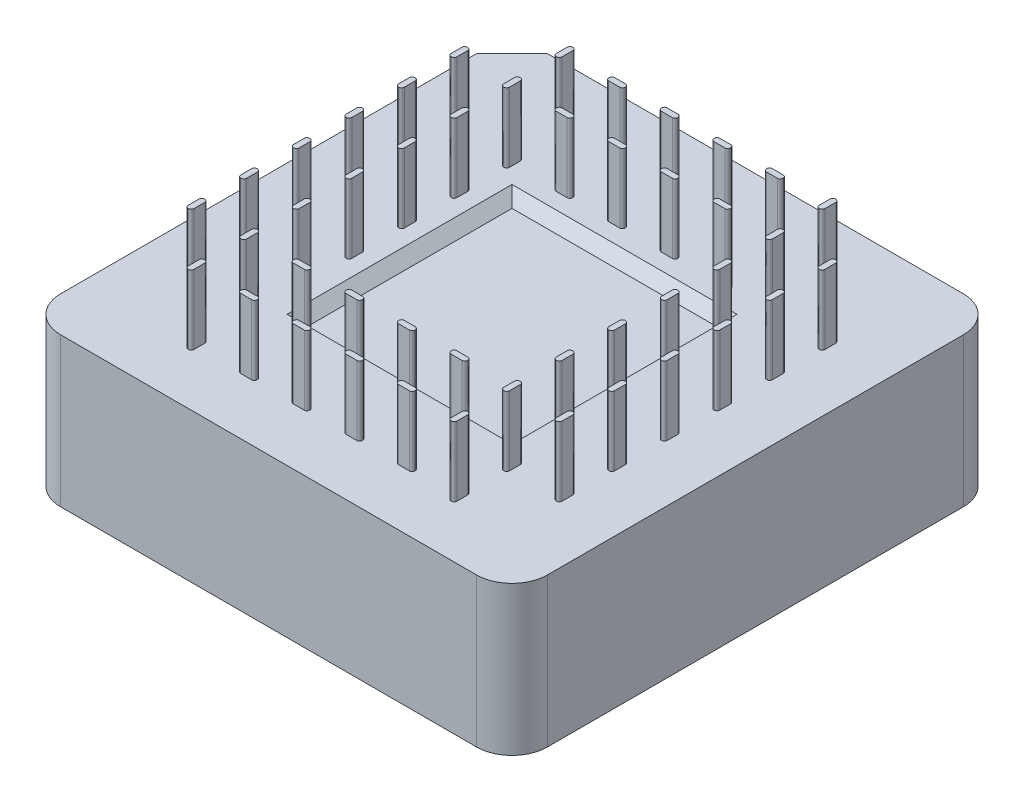
from build123d import *

# Parameters (mm, degrees)
SALIENTE_EXTRUIR1_DEPTH    = 3.3528
SALIENTE_EXTRUIR1_2_DEPTH  = 3.3528
SALIENTE_EXTRUIR1_3_DEPTH  = 3.3528
SALIENTE_EXTRUIR1_4_DEPTH  = 3.3528
SALIENTE_EXTRUIR1_5_DEPTH  = 3.3528
SALIENTE_EXTRUIR1_6_DEPTH  = 3.3528
SALIENTE_EXTRUIR1_7_DEPTH  = 3.3528
SALIENTE_EXTRUIR1_8_DEPTH  = 3.3528
SALIENTE_EXTRUIR1_9_DEPTH  = 3.3528
SALIENTE_EXTRUIR1_10_DEPTH = 3.3528
SALIENTE_EXTRUIR1_11_DEPTH = 3.3528
SALIENTE_EXTRUIR1_12_DEPTH = 3.3528
SALIENTE_EXTRUIR1_13_DEPTH = 3.3528
SALIENTE_EXTRUIR1_14_DEPTH = 3.3528
SALIENTE_EXTRUIR1_15_DEPTH = 3.3528
SALIENTE_EXTRUIR1_16_DEPTH = 3.3528
SALIENTE_EXTRUIR1_17_DEPTH = 3.3528
SALIENTE_EXTRUIR1_18_DEPTH = 3.3528
SALIENTE_EXTRUIR1_19_DEPTH = 3.3528
SALIENTE_EXTRUIR1_20_DEPTH = 3.3528
SALIENTE_EXTRUIR1_21_DEPTH = 3.3528
SALIENTE_EXTRUIR1_22_DEPTH = 3.3528
SALIENTE_EXTRUIR1_23_DEPTH = 3.3528
SALIENTE_EXTRUIR1_24_DEPTH = 3.3528
SALIENTE_EXTRUIR1_25_DEPTH = 3.3528
SALIENTE_EXTRUIR1_26_DEPTH = 3.3528
SALIENTE_EXTRUIR1_27_DEPTH = 3.3528
SALIENTE_EXTRUIR1_28_DEPTH = 3.3528
SALIENTE_EXTRUIR1_29_DEPTH = 3.3528
SALIENTE_EXTRUIR1_30_DEPTH = 3.3528
SALIENTE_EXTRUIR1_31_DEPTH = 3.3528
SALIENTE_EXTRUIR1_32_DEPTH = 3.3528
SALIENTE_EXTRUIR1_33_DEPTH = 3.3528
SALIENTE_EXTRUIR1_34_DEPTH = 3.3528
SALIENTE_EXTRUIR1_35_DEPTH = 3.3528
SALIENTE_EXTRUIR1_36_DEPTH = 3.3528
SALIENTE_EXTRUIR1_37_DEPTH = 3.3528
SALIENTE_EXTRUIR1_38_DEPTH = 3.3528
SALIENTE_EXTRUIR1_39_DEPTH = 3.3528
SALIENTE_EXTRUIR1_40_DEPTH = 3.3528
SALIENTE_EXTRUIR1_41_DEPTH = 3.3528
SALIENTE_EXTRUIR1_42_DEPTH = 3.3528
SALIENTE_EXTRUIR1_43_DEPTH = 3.3528
SALIENTE_EXTRUIR1_44_DEPTH = 3.3528
SALIENTE_EXTRUIR2_DEPTH    = 7.2
CROQUIS3_W                 = 11
CROQUIS3_H                 = 11
CORTAR_EXTRUIR1_DEPTH      = 0.5
CHAFL_N1_SIZE              = 0.569214
CORTAR_EXTRUIR2_DEPTH      = 5


with BuildPart() as part:
    # Croquis1 → Saliente-Extruir1 (new body)
    with BuildSketch(Plane(origin=(0, 0, 0), x_dir=(1, 0, 0), z_dir=(0, 1, 0))):
        with BuildLine():
            Line((-6.343218917, -8.4963), (-6.356781083, -8.4963))
            ThreePointArc((-6.356781083, -8.4963), (-6.450768951, -8.535231049), (-6.4897, -8.629218917))
            Line((-6.4897, -8.629218917), (-6.4897, -9.150781083))
            ThreePointArc((-6.4897, -9.150781083), (-6.450768951, -9.244768951), (-6.356781083, -9.2837))
            Line((-6.356781083, -9.2837), (-6.343218917, -9.2837))
            ThreePointArc((-6.343218917, -9.2837), (-6.249231049, -9.244768951), (-6.2103, -9.150781083))
            Line((-6.2103, -9.150781083), (-6.2103, -8.629218917))
            ThreePointArc((-6.2103, -8.629218917), (-6.249231049, -8.535231049), (-6.343218917, -8.4963))
        make_face()
    extrude(amount=SALIENTE_EXTRUIR1_DEPTH)



with BuildPart() as body_2:
    # Croquis1 → Saliente-Extruir1 2 (new body)
    with BuildSketch(Plane(origin=(0, 0, 0), x_dir=(1, 0, 0), z_dir=(0, 1, 0))):
        with BuildLine():
            Line((-8.896781083, -1.6637), (-8.883218917, -1.6637))
            ThreePointArc((-8.883218917, -1.6637), (-8.789231049, -1.624768951), (-8.7503, -1.530781083))
            Line((-8.7503, -1.530781083), (-8.7503, -1.009218917))
            ThreePointArc((-8.7503, -1.009218917), (-8.789231049, -0.915231049), (-8.883218917, -0.8763))
            Line((-8.883218917, -0.8763), (-8.896781083, -0.8763))
            ThreePointArc((-8.896781083, -0.8763), (-8.990768951, -0.915231049), (-9.0297, -1.009218917))
            Line((-9.0297, -1.009218917), (-9.0297, -1.530781083))
            ThreePointArc((-9.0297, -1.530781083), (-8.990768951, -1.624768951), (-8.896781083, -1.6637))
        make_face()
    extrude(amount=SALIENTE_EXTRUIR1_2_DEPTH)


with BuildPart() as body_3:
    # Croquis1 → Saliente-Extruir1 3 (new body)
    with BuildSketch(Plane(origin=(0, 0, 0), x_dir=(1, 0, 0), z_dir=(0, 1, 0))):
        with BuildLine():
            Line((-6.4897, -1.530781083), (-6.4897, -1.009218917))
            ThreePointArc((-6.4897, -1.009218917), (-6.450768951, -0.915231049), (-6.356781083, -0.8763))
            Line((-6.356781083, -0.8763), (-6.343218917, -0.8763))
            ThreePointArc((-6.343218917, -0.8763), (-6.249231049, -0.915231049), (-6.2103, -1.009218917))
            Line((-6.2103, -1.009218917), (-6.2103, -1.530781083))
            ThreePointArc((-6.2103, -1.530781083), (-6.249231049, -1.624768951), (-6.343218917, -1.6637))
            Line((-6.343218917, -1.6637), (-6.356781083, -1.6637))
            ThreePointArc((-6.356781083, -1.6637), (-6.450768951, -1.624768951), (-6.4897, -1.530781083))
        make_face()
    extrude(amount=SALIENTE_EXTRUIR1_3_DEPTH)


with BuildPart() as body_4:
    # Croquis1 → Saliente-Extruir1 4 (new body)
    with BuildSketch(Plane(origin=(0, 0, 0), x_dir=(1, 0, 0), z_dir=(0, 1, 0))):
        with BuildLine():
            Line((-6.343218917, -3.4163), (-6.356781083, -3.4163))
            ThreePointArc((-6.356781083, -3.4163), (-6.450768951, -3.455231049), (-6.4897, -3.549218917))
            Line((-6.4897, -3.549218917), (-6.4897, -4.070781083))
            ThreePointArc((-6.4897, -4.070781083), (-6.450768951, -4.164768951), (-6.356781083, -4.2037))
            Line((-6.356781083, -4.2037), (-6.343218917, -4.2037))
            ThreePointArc((-6.343218917, -4.2037), (-6.249231049, -4.164768951), (-6.2103, -4.070781083))
            Line((-6.2103, -4.070781083), (-6.2103, -3.549218917))
            ThreePointArc((-6.2103, -3.549218917), (-6.249231049, -3.455231049), (-6.343218917, -3.4163))
        make_face()
    extrude(amount=SALIENTE_EXTRUIR1_4_DEPTH)


with BuildPart() as body_5:
    # Croquis1 → Saliente-Extruir1 5 (new body)
    with BuildSketch(Plane(origin=(0, 0, 0), x_dir=(1, 0, 0), z_dir=(0, 1, 0))):
        with BuildLine():
            Line((-8.7503, -3.549218917), (-8.7503, -4.070781083))
            ThreePointArc((-8.7503, -4.070781083), (-8.789231049, -4.164768951), (-8.883218917, -4.2037))
            Line((-8.883218917, -4.2037), (-8.896781083, -4.2037))
            ThreePointArc((-8.896781083, -4.2037), (-8.990768951, -4.164768951), (-9.0297, -4.070781083))
            Line((-9.0297, -4.070781083), (-9.0297, -3.549218917))
            ThreePointArc((-9.0297, -3.549218917), (-8.990768951, -3.455231049), (-8.896781083, -3.4163))
            Line((-8.896781083, -3.4163), (-8.883218917, -3.4163))
            ThreePointArc((-8.883218917, -3.4163), (-8.789231049, -3.455231049), (-8.7503, -3.549218917))
        make_face()
    extrude(amount=SALIENTE_EXTRUIR1_5_DEPTH)


with BuildPart() as body_6:
    # Croquis1 → Saliente-Extruir1 6 (new body)
    with BuildSketch(Plane(origin=(0, 0, 0), x_dir=(1, 0, 0), z_dir=(0, 1, 0))):
        with BuildLine():
            Line((-8.896781083, -6.7437), (-8.883218917, -6.7437))
            ThreePointArc((-8.883218917, -6.7437), (-8.789231049, -6.704768951), (-8.7503, -6.610781083))
            Line((-8.7503, -6.610781083), (-8.7503, -6.089218917))
            ThreePointArc((-8.7503, -6.089218917), (-8.789231049, -5.995231049), (-8.883218917, -5.9563))
            Line((-8.883218917, -5.9563), (-8.896781083, -5.9563))
            ThreePointArc((-8.896781083, -5.9563), (-8.990768951, -5.995231049), (-9.0297, -6.089218917))
            Line((-9.0297, -6.089218917), (-9.0297, -6.610781083))
            ThreePointArc((-9.0297, -6.610781083), (-8.990768951, -6.704768951), (-8.896781083, -6.7437))
        make_face()
    extrude(amount=SALIENTE_EXTRUIR1_6_DEPTH)


with BuildPart() as body_7:
    # Croquis1 → Saliente-Extruir1 7 (new body)
    with BuildSketch(Plane(origin=(0, 0, 0), x_dir=(1, 0, 0), z_dir=(0, 1, 0))):
        with BuildLine():
            Line((-6.4897, -6.610781083), (-6.4897, -6.089218917))
            ThreePointArc((-6.4897, -6.089218917), (-6.450768951, -5.995231049), (-6.356781083, -5.9563))
            Line((-6.356781083, -5.9563), (-6.343218917, -5.9563))
            ThreePointArc((-6.343218917, -5.9563), (-6.249231049, -5.995231049), (-6.2103, -6.089218917))
            Line((-6.2103, -6.089218917), (-6.2103, -6.610781083))
            ThreePointArc((-6.2103, -6.610781083), (-6.249231049, -6.704768951), (-6.343218917, -6.7437))
            Line((-6.343218917, -6.7437), (-6.356781083, -6.7437))
            ThreePointArc((-6.356781083, -6.7437), (-6.450768951, -6.704768951), (-6.4897, -6.610781083))
        make_face()
    extrude(amount=SALIENTE_EXTRUIR1_7_DEPTH)


with BuildPart() as body_8:
    # Croquis1 → Saliente-Extruir1 8 (new body)
    with BuildSketch(Plane(origin=(0, 0, 0), x_dir=(1, 0, 0), z_dir=(0, 1, 0))):
        with BuildLine():
            Line((-6.343218917, 6.7437), (-6.356781083, 6.7437))
            ThreePointArc((-6.356781083, 6.7437), (-6.450768951, 6.704768951), (-6.4897, 6.610781083))
            Line((-6.4897, 6.610781083), (-6.4897, 6.089218917))
            ThreePointArc((-6.4897, 6.089218917), (-6.450768951, 5.995231049), (-6.356781083, 5.9563))
            Line((-6.356781083, 5.9563), (-6.343218917, 5.9563))
            ThreePointArc((-6.343218917, 5.9563), (-6.249231049, 5.995231049), (-6.2103, 6.089218917))
            Line((-6.2103, 6.089218917), (-6.2103, 6.610781083))
            ThreePointArc((-6.2103, 6.610781083), (-6.249231049, 6.704768951), (-6.343218917, 6.7437))
        make_face()
    extrude(amount=SALIENTE_EXTRUIR1_8_DEPTH)


with BuildPart() as body_9:
    # Croquis1 → Saliente-Extruir1 9 (new body)
    with BuildSketch(Plane(origin=(0, 0, 0), x_dir=(1, 0, 0), z_dir=(0, 1, 0))):
        with BuildLine():
            Line((-8.7503, 6.610781083), (-8.7503, 6.089218917))
            ThreePointArc((-8.7503, 6.089218917), (-8.789231049, 5.995231049), (-8.883218917, 5.9563))
            Line((-8.883218917, 5.9563), (-8.896781083, 5.9563))
            ThreePointArc((-8.896781083, 5.9563), (-8.990768951, 5.995231049), (-9.0297, 6.089218917))
            Line((-9.0297, 6.089218917), (-9.0297, 6.610781083))
            ThreePointArc((-9.0297, 6.610781083), (-8.990768951, 6.704768951), (-8.896781083, 6.7437))
            Line((-8.896781083, 6.7437), (-8.883218917, 6.7437))
            ThreePointArc((-8.883218917, 6.7437), (-8.789231049, 6.704768951), (-8.7503, 6.610781083))
        make_face()
    extrude(amount=SALIENTE_EXTRUIR1_9_DEPTH)


with BuildPart() as body_10:
    # Croquis1 → Saliente-Extruir1 10 (new body)
    with BuildSketch(Plane(origin=(0, 0, 0), x_dir=(1, 0, 0), z_dir=(0, 1, 0))):
        with BuildLine():
            Line((-8.896781083, 3.4163), (-8.883218917, 3.4163))
            ThreePointArc((-8.883218917, 3.4163), (-8.789231049, 3.455231049), (-8.7503, 3.549218917))
            Line((-8.7503, 3.549218917), (-8.7503, 4.070781083))
            ThreePointArc((-8.7503, 4.070781083), (-8.789231049, 4.164768951), (-8.883218917, 4.2037))
            Line((-8.883218917, 4.2037), (-8.896781083, 4.2037))
            ThreePointArc((-8.896781083, 4.2037), (-8.990768951, 4.164768951), (-9.0297, 4.070781083))
            Line((-9.0297, 4.070781083), (-9.0297, 3.549218917))
            ThreePointArc((-9.0297, 3.549218917), (-8.990768951, 3.455231049), (-8.896781083, 3.4163))
        make_face()
    extrude(amount=SALIENTE_EXTRUIR1_10_DEPTH)


with BuildPart() as body_11:
    # Croquis1 → Saliente-Extruir1 11 (new body)
    with BuildSketch(Plane(origin=(0, 0, 0), x_dir=(1, 0, 0), z_dir=(0, 1, 0))):
        with BuildLine():
            Line((-6.4897, 3.549218917), (-6.4897, 4.070781083))
            ThreePointArc((-6.4897, 4.070781083), (-6.450768951, 4.164768951), (-6.356781083, 4.2037))
            Line((-6.356781083, 4.2037), (-6.343218917, 4.2037))
            ThreePointArc((-6.343218917, 4.2037), (-6.249231049, 4.164768951), (-6.2103, 4.070781083))
            Line((-6.2103, 4.070781083), (-6.2103, 3.549218917))
            ThreePointArc((-6.2103, 3.549218917), (-6.249231049, 3.455231049), (-6.343218917, 3.4163))
            Line((-6.343218917, 3.4163), (-6.356781083, 3.4163))
            ThreePointArc((-6.356781083, 3.4163), (-6.450768951, 3.455231049), (-6.4897, 3.549218917))
        make_face()
    extrude(amount=SALIENTE_EXTRUIR1_11_DEPTH)


with BuildPart() as body_12:
    # Croquis1 → Saliente-Extruir1 12 (new body)
    with BuildSketch(Plane(origin=(0, 0, 0), x_dir=(1, 0, 0), z_dir=(0, 1, 0))):
        with BuildLine():
            Line((-6.343218917, 1.6637), (-6.356781083, 1.6637))
            ThreePointArc((-6.356781083, 1.6637), (-6.450768951, 1.624768951), (-6.4897, 1.530781083))
            Line((-6.4897, 1.530781083), (-6.4897, 1.009218917))
            ThreePointArc((-6.4897, 1.009218917), (-6.450768951, 0.915231049), (-6.356781083, 0.8763))
            Line((-6.356781083, 0.8763), (-6.343218917, 0.8763))
            ThreePointArc((-6.343218917, 0.8763), (-6.249231049, 0.915231049), (-6.2103, 1.009218917))
            Line((-6.2103, 1.009218917), (-6.2103, 1.530781083))
            ThreePointArc((-6.2103, 1.530781083), (-6.249231049, 1.624768951), (-6.343218917, 1.6637))
        make_face()
    extrude(amount=SALIENTE_EXTRUIR1_12_DEPTH)


with BuildPart() as body_13:
    # Croquis1 → Saliente-Extruir1 13 (new body)
    with BuildSketch(Plane(origin=(0, 0, 0), x_dir=(1, 0, 0), z_dir=(0, 1, 0))):
        with BuildLine():
            Line((-8.7503, 1.530781083), (-8.7503, 1.009218917))
            ThreePointArc((-8.7503, 1.009218917), (-8.789231049, 0.915231049), (-8.883218917, 0.8763))
            Line((-8.883218917, 0.8763), (-8.896781083, 0.8763))
            ThreePointArc((-8.896781083, 0.8763), (-8.990768951, 0.915231049), (-9.0297, 1.009218917))
            Line((-9.0297, 1.009218917), (-9.0297, 1.530781083))
            ThreePointArc((-9.0297, 1.530781083), (-8.990768951, 1.624768951), (-8.896781083, 1.6637))
            Line((-8.896781083, 1.6637), (-8.883218917, 1.6637))
            ThreePointArc((-8.883218917, 1.6637), (-8.789231049, 1.624768951), (-8.7503, 1.530781083))
        make_face()
    extrude(amount=SALIENTE_EXTRUIR1_13_DEPTH)


with BuildPart() as body_14:
    # Croquis1 → Saliente-Extruir1 14 (new body)
    with BuildSketch(Plane(origin=(0, 0, 0), x_dir=(1, 0, 0), z_dir=(0, 1, 0))):
        with BuildLine():
            Line((-6.4897, 8.629218917), (-6.4897, 9.150781083))
            ThreePointArc((-6.4897, 9.150781083), (-6.450768951, 9.244768951), (-6.356781083, 9.2837))
            Line((-6.356781083, 9.2837), (-6.343218917, 9.2837))
            ThreePointArc((-6.343218917, 9.2837), (-6.249231049, 9.244768951), (-6.2103, 9.150781083))
            Line((-6.2103, 9.150781083), (-6.2103, 8.629218917))
            ThreePointArc((-6.2103, 8.629218917), (-6.249231049, 8.535231049), (-6.343218917, 8.4963))
            Line((-6.343218917, 8.4963), (-6.356781083, 8.4963))
            ThreePointArc((-6.356781083, 8.4963), (-6.450768951, 8.535231049), (-6.4897, 8.629218917))
        make_face()
    extrude(amount=SALIENTE_EXTRUIR1_14_DEPTH)


with BuildPart() as body_15:
    # Croquis1 → Saliente-Extruir1 15 (new body)
    with BuildSketch(Plane(origin=(0, 0, 0), x_dir=(1, 0, 0), z_dir=(0, 1, 0))):
        with BuildLine():
            Line((6.343218917, 8.4963), (6.356781083, 8.4963))
            ThreePointArc((6.356781083, 8.4963), (6.450768951, 8.535231049), (6.4897, 8.629218917))
            Line((6.4897, 8.629218917), (6.4897, 9.150781083))
            ThreePointArc((6.4897, 9.150781083), (6.450768951, 9.244768951), (6.356781083, 9.2837))
            Line((6.356781083, 9.2837), (6.343218917, 9.2837))
            ThreePointArc((6.343218917, 9.2837), (6.249231049, 9.244768951), (6.2103, 9.150781083))
            Line((6.2103, 9.150781083), (6.2103, 8.629218917))
            ThreePointArc((6.2103, 8.629218917), (6.249231049, 8.535231049), (6.343218917, 8.4963))
        make_face()
    extrude(amount=SALIENTE_EXTRUIR1_15_DEPTH)


with BuildPart() as body_16:
    # Croquis1 → Saliente-Extruir1 16 (new body)
    with BuildSketch(Plane(origin=(0, 0, 0), x_dir=(1, 0, 0), z_dir=(0, 1, 0))):
        with BuildLine():
            Line((8.896781083, 1.6637), (8.883218917, 1.6637))
            ThreePointArc((8.883218917, 1.6637), (8.789231049, 1.624768951), (8.7503, 1.530781083))
            Line((8.7503, 1.530781083), (8.7503, 1.009218917))
            ThreePointArc((8.7503, 1.009218917), (8.789231049, 0.915231049), (8.883218917, 0.8763))
            Line((8.883218917, 0.8763), (8.896781083, 0.8763))
            ThreePointArc((8.896781083, 0.8763), (8.990768951, 0.915231049), (9.0297, 1.009218917))
            Line((9.0297, 1.009218917), (9.0297, 1.530781083))
            ThreePointArc((9.0297, 1.530781083), (8.990768951, 1.624768951), (8.896781083, 1.6637))
        make_face()
    extrude(amount=SALIENTE_EXTRUIR1_16_DEPTH)


with BuildPart() as body_17:
    # Croquis1 → Saliente-Extruir1 17 (new body)
    with BuildSketch(Plane(origin=(0, 0, 0), x_dir=(1, 0, 0), z_dir=(0, 1, 0))):
        with BuildLine():
            Line((6.4897, 1.530781083), (6.4897, 1.009218917))
            ThreePointArc((6.4897, 1.009218917), (6.450768951, 0.915231049), (6.356781083, 0.8763))
            Line((6.356781083, 0.8763), (6.343218917, 0.8763))
            ThreePointArc((6.343218917, 0.8763), (6.249231049, 0.915231049), (6.2103, 1.009218917))
            Line((6.2103, 1.009218917), (6.2103, 1.530781083))
            ThreePointArc((6.2103, 1.530781083), (6.249231049, 1.624768951), (6.343218917, 1.6637))
            Line((6.343218917, 1.6637), (6.356781083, 1.6637))
            ThreePointArc((6.356781083, 1.6637), (6.450768951, 1.624768951), (6.4897, 1.530781083))
        make_face()
    extrude(amount=SALIENTE_EXTRUIR1_17_DEPTH)


with BuildPart() as body_18:
    # Croquis1 → Saliente-Extruir1 18 (new body)
    with BuildSketch(Plane(origin=(0, 0, 0), x_dir=(1, 0, 0), z_dir=(0, 1, 0))):
        with BuildLine():
            Line((6.343218917, 3.4163), (6.356781083, 3.4163))
            ThreePointArc((6.356781083, 3.4163), (6.450768951, 3.455231049), (6.4897, 3.549218917))
            Line((6.4897, 3.549218917), (6.4897, 4.070781083))
            ThreePointArc((6.4897, 4.070781083), (6.450768951, 4.164768951), (6.356781083, 4.2037))
            Line((6.356781083, 4.2037), (6.343218917, 4.2037))
            ThreePointArc((6.343218917, 4.2037), (6.249231049, 4.164768951), (6.2103, 4.070781083))
            Line((6.2103, 4.070781083), (6.2103, 3.549218917))
            ThreePointArc((6.2103, 3.549218917), (6.249231049, 3.455231049), (6.343218917, 3.4163))
        make_face()
    extrude(amount=SALIENTE_EXTRUIR1_18_DEPTH)


with BuildPart() as body_19:
    # Croquis1 → Saliente-Extruir1 19 (new body)
    with BuildSketch(Plane(origin=(0, 0, 0), x_dir=(1, 0, 0), z_dir=(0, 1, 0))):
        with BuildLine():
            Line((8.7503, 3.549218917), (8.7503, 4.070781083))
            ThreePointArc((8.7503, 4.070781083), (8.789231049, 4.164768951), (8.883218917, 4.2037))
            Line((8.883218917, 4.2037), (8.896781083, 4.2037))
            ThreePointArc((8.896781083, 4.2037), (8.990768951, 4.164768951), (9.0297, 4.070781083))
            Line((9.0297, 4.070781083), (9.0297, 3.549218917))
            ThreePointArc((9.0297, 3.549218917), (8.990768951, 3.455231049), (8.896781083, 3.4163))
            Line((8.896781083, 3.4163), (8.883218917, 3.4163))
            ThreePointArc((8.883218917, 3.4163), (8.789231049, 3.455231049), (8.7503, 3.549218917))
        make_face()
    extrude(amount=SALIENTE_EXTRUIR1_19_DEPTH)


with BuildPart() as body_20:
    # Croquis1 → Saliente-Extruir1 20 (new body)
    with BuildSketch(Plane(origin=(0, 0, 0), x_dir=(1, 0, 0), z_dir=(0, 1, 0))):
        with BuildLine():
            Line((8.896781083, 6.7437), (8.883218917, 6.7437))
            ThreePointArc((8.883218917, 6.7437), (8.789231049, 6.704768951), (8.7503, 6.610781083))
            Line((8.7503, 6.610781083), (8.7503, 6.089218917))
            ThreePointArc((8.7503, 6.089218917), (8.789231049, 5.995231049), (8.883218917, 5.9563))
            Line((8.883218917, 5.9563), (8.896781083, 5.9563))
            ThreePointArc((8.896781083, 5.9563), (8.990768951, 5.995231049), (9.0297, 6.089218917))
            Line((9.0297, 6.089218917), (9.0297, 6.610781083))
            ThreePointArc((9.0297, 6.610781083), (8.990768951, 6.704768951), (8.896781083, 6.7437))
        make_face()
    extrude(amount=SALIENTE_EXTRUIR1_20_DEPTH)


with BuildPart() as body_21:
    # Croquis1 → Saliente-Extruir1 21 (new body)
    with BuildSketch(Plane(origin=(0, 0, 0), x_dir=(1, 0, 0), z_dir=(0, 1, 0))):
        with BuildLine():
            Line((6.4897, 6.610781083), (6.4897, 6.089218917))
            ThreePointArc((6.4897, 6.089218917), (6.450768951, 5.995231049), (6.356781083, 5.9563))
            Line((6.356781083, 5.9563), (6.343218917, 5.9563))
            ThreePointArc((6.343218917, 5.9563), (6.249231049, 5.995231049), (6.2103, 6.089218917))
            Line((6.2103, 6.089218917), (6.2103, 6.610781083))
            ThreePointArc((6.2103, 6.610781083), (6.249231049, 6.704768951), (6.343218917, 6.7437))
            Line((6.343218917, 6.7437), (6.356781083, 6.7437))
            ThreePointArc((6.356781083, 6.7437), (6.450768951, 6.704768951), (6.4897, 6.610781083))
        make_face()
    extrude(amount=SALIENTE_EXTRUIR1_21_DEPTH)


with BuildPart() as body_22:
    # Croquis1 → Saliente-Extruir1 22 (new body)
    with BuildSketch(Plane(origin=(0, 0, 0), x_dir=(1, 0, 0), z_dir=(0, 1, 0))):
        with BuildLine():
            Line((6.343218917, -6.7437), (6.356781083, -6.7437))
            ThreePointArc((6.356781083, -6.7437), (6.450768951, -6.704768951), (6.4897, -6.610781083))
            Line((6.4897, -6.610781083), (6.4897, -6.089218917))
            ThreePointArc((6.4897, -6.089218917), (6.450768951, -5.995231049), (6.356781083, -5.9563))
            Line((6.356781083, -5.9563), (6.343218917, -5.9563))
            ThreePointArc((6.343218917, -5.9563), (6.249231049, -5.995231049), (6.2103, -6.089218917))
            Line((6.2103, -6.089218917), (6.2103, -6.610781083))
            ThreePointArc((6.2103, -6.610781083), (6.249231049, -6.704768951), (6.343218917, -6.7437))
        make_face()
    extrude(amount=SALIENTE_EXTRUIR1_22_DEPTH)


with BuildPart() as body_23:
    # Croquis1 → Saliente-Extruir1 23 (new body)
    with BuildSketch(Plane(origin=(0, 0, 0), x_dir=(1, 0, 0), z_dir=(0, 1, 0))):
        with BuildLine():
            Line((8.7503, -6.610781083), (8.7503, -6.089218917))
            ThreePointArc((8.7503, -6.089218917), (8.789231049, -5.995231049), (8.883218917, -5.9563))
            Line((8.883218917, -5.9563), (8.896781083, -5.9563))
            ThreePointArc((8.896781083, -5.9563), (8.990768951, -5.995231049), (9.0297, -6.089218917))
            Line((9.0297, -6.089218917), (9.0297, -6.610781083))
            ThreePointArc((9.0297, -6.610781083), (8.990768951, -6.704768951), (8.896781083, -6.7437))
            Line((8.896781083, -6.7437), (8.883218917, -6.7437))
            ThreePointArc((8.883218917, -6.7437), (8.789231049, -6.704768951), (8.7503, -6.610781083))
        make_face()
    extrude(amount=SALIENTE_EXTRUIR1_23_DEPTH)


with BuildPart() as body_24:
    # Croquis1 → Saliente-Extruir1 24 (new body)
    with BuildSketch(Plane(origin=(0, 0, 0), x_dir=(1, 0, 0), z_dir=(0, 1, 0))):
        with BuildLine():
            Line((8.896781083, -3.4163), (8.883218917, -3.4163))
            ThreePointArc((8.883218917, -3.4163), (8.789231049, -3.455231049), (8.7503, -3.549218917))
            Line((8.7503, -3.549218917), (8.7503, -4.070781083))
            ThreePointArc((8.7503, -4.070781083), (8.789231049, -4.164768951), (8.883218917, -4.2037))
            Line((8.883218917, -4.2037), (8.896781083, -4.2037))
            ThreePointArc((8.896781083, -4.2037), (8.990768951, -4.164768951), (9.0297, -4.070781083))
            Line((9.0297, -4.070781083), (9.0297, -3.549218917))
            ThreePointArc((9.0297, -3.549218917), (8.990768951, -3.455231049), (8.896781083, -3.4163))
        make_face()
    extrude(amount=SALIENTE_EXTRUIR1_24_DEPTH)


with BuildPart() as body_25:
    # Croquis1 → Saliente-Extruir1 25 (new body)
    with BuildSketch(Plane(origin=(0, 0, 0), x_dir=(1, 0, 0), z_dir=(0, 1, 0))):
        with BuildLine():
            Line((6.4897, -3.549218917), (6.4897, -4.070781083))
            ThreePointArc((6.4897, -4.070781083), (6.450768951, -4.164768951), (6.356781083, -4.2037))
            Line((6.356781083, -4.2037), (6.343218917, -4.2037))
            ThreePointArc((6.343218917, -4.2037), (6.249231049, -4.164768951), (6.2103, -4.070781083))
            Line((6.2103, -4.070781083), (6.2103, -3.549218917))
            ThreePointArc((6.2103, -3.549218917), (6.249231049, -3.455231049), (6.343218917, -3.4163))
            Line((6.343218917, -3.4163), (6.356781083, -3.4163))
            ThreePointArc((6.356781083, -3.4163), (6.450768951, -3.455231049), (6.4897, -3.549218917))
        make_face()
    extrude(amount=SALIENTE_EXTRUIR1_25_DEPTH)


with BuildPart() as body_26:
    # Croquis1 → Saliente-Extruir1 26 (new body)
    with BuildSketch(Plane(origin=(0, 0, 0), x_dir=(1, 0, 0), z_dir=(0, 1, 0))):
        with BuildLine():
            Line((6.343218917, -1.6637), (6.356781083, -1.6637))
            ThreePointArc((6.356781083, -1.6637), (6.450768951, -1.624768951), (6.4897, -1.530781083))
            Line((6.4897, -1.530781083), (6.4897, -1.009218917))
            ThreePointArc((6.4897, -1.009218917), (6.450768951, -0.915231049), (6.356781083, -0.8763))
            Line((6.356781083, -0.8763), (6.343218917, -0.8763))
            ThreePointArc((6.343218917, -0.8763), (6.249231049, -0.915231049), (6.2103, -1.009218917))
            Line((6.2103, -1.009218917), (6.2103, -1.530781083))
            ThreePointArc((6.2103, -1.530781083), (6.249231049, -1.624768951), (6.343218917, -1.6637))
        make_face()
    extrude(amount=SALIENTE_EXTRUIR1_26_DEPTH)


with BuildPart() as body_27:
    # Croquis1 → Saliente-Extruir1 27 (new body)
    with BuildSketch(Plane(origin=(0, 0, 0), x_dir=(1, 0, 0), z_dir=(0, 1, 0))):
        with BuildLine():
            Line((8.7503, -1.530781083), (8.7503, -1.009218917))
            ThreePointArc((8.7503, -1.009218917), (8.789231049, -0.915231049), (8.883218917, -0.8763))
            Line((8.883218917, -0.8763), (8.896781083, -0.8763))
            ThreePointArc((8.896781083, -0.8763), (8.990768951, -0.915231049), (9.0297, -1.009218917))
            Line((9.0297, -1.009218917), (9.0297, -1.530781083))
            ThreePointArc((9.0297, -1.530781083), (8.990768951, -1.624768951), (8.896781083, -1.6637))
            Line((8.896781083, -1.6637), (8.883218917, -1.6637))
            ThreePointArc((8.883218917, -1.6637), (8.789231049, -1.624768951), (8.7503, -1.530781083))
        make_face()
    extrude(amount=SALIENTE_EXTRUIR1_27_DEPTH)


with BuildPart() as body_28:
    # Croquis1 → Saliente-Extruir1 28 (new body)
    with BuildSketch(Plane(origin=(0, 0, 0), x_dir=(1, 0, 0), z_dir=(0, 1, 0))):
        with BuildLine():
            Line((6.4897, -8.629218917), (6.4897, -9.150781083))
            ThreePointArc((6.4897, -9.150781083), (6.450768951, -9.244768951), (6.356781083, -9.2837))
            Line((6.356781083, -9.2837), (6.343218917, -9.2837))
            ThreePointArc((6.343218917, -9.2837), (6.249231049, -9.244768951), (6.2103, -9.150781083))
            Line((6.2103, -9.150781083), (6.2103, -8.629218917))
            ThreePointArc((6.2103, -8.629218917), (6.249231049, -8.535231049), (6.343218917, -8.4963))
            Line((6.343218917, -8.4963), (6.356781083, -8.4963))
            ThreePointArc((6.356781083, -8.4963), (6.450768951, -8.535231049), (6.4897, -8.629218917))
        make_face()
    extrude(amount=SALIENTE_EXTRUIR1_28_DEPTH)


with BuildPart() as body_29:
    # Croquis1 → Saliente-Extruir1 29 (new body)
    with BuildSketch(Plane(origin=(0, 0, 0), x_dir=(1, 0, 0), z_dir=(0, 1, 0))):
        with BuildLine():
            Line((-3.542618838, -6.2103), (-4.077381162, -6.2103))
            ThreePointArc((-4.077381162, -6.2103), (-4.166702069, -6.247297931), (-4.2037, -6.336618838))
            Line((-4.2037, -6.336618838), (-4.2037, -6.363381162))
            ThreePointArc((-4.2037, -6.363381162), (-4.166702069, -6.452702069), (-4.077381162, -6.4897))
            Line((-4.077381162, -6.4897), (-3.542618838, -6.4897))
            ThreePointArc((-3.542618838, -6.4897), (-3.453297931, -6.452702069), (-3.4163, -6.363381162))
            Line((-3.4163, -6.363381162), (-3.4163, -6.336618838))
            ThreePointArc((-3.4163, -6.336618838), (-3.453297931, -6.247297931), (-3.542618838, -6.2103))
        make_face()
    extrude(amount=SALIENTE_EXTRUIR1_29_DEPTH)


with BuildPart() as body_30:
    # Croquis1 → Saliente-Extruir1 30 (new body)
    with BuildSketch(Plane(origin=(0, 0, 0), x_dir=(1, 0, 0), z_dir=(0, 1, 0))):
        with BuildLine():
            Line((-0.8763, -6.336618838), (-0.8763, -6.363381162))
            ThreePointArc((-0.8763, -6.363381162), (-0.913297931, -6.452702069), (-1.002618838, -6.4897))
            Line((-1.002618838, -6.4897), (-1.537381162, -6.4897))
            ThreePointArc((-1.537381162, -6.4897), (-1.626702069, -6.452702069), (-1.6637, -6.363381162))
            Line((-1.6637, -6.363381162), (-1.6637, -6.336618838))
            ThreePointArc((-1.6637, -6.336618838), (-1.626702069, -6.247297931), (-1.537381162, -6.2103))
            Line((-1.537381162, -6.2103), (-1.002618838, -6.2103))
            ThreePointArc((-1.002618838, -6.2103), (-0.913297931, -6.247297931), (-0.8763, -6.336618838))
        make_face()
    extrude(amount=SALIENTE_EXTRUIR1_30_DEPTH)


with BuildPart() as body_31:
    # Croquis1 → Saliente-Extruir1 31 (new body)
    with BuildSketch(Plane(origin=(0, 0, 0), x_dir=(1, 0, 0), z_dir=(0, 1, 0))):
        with BuildLine():
            Line((1.537381162, -6.2103), (1.002618838, -6.2103))
            ThreePointArc((1.002618838, -6.2103), (0.913297931, -6.247297931), (0.8763, -6.336618838))
            Line((0.8763, -6.336618838), (0.8763, -6.363381162))
            ThreePointArc((0.8763, -6.363381162), (0.913297931, -6.452702069), (1.002618838, -6.4897))
            Line((1.002618838, -6.4897), (1.537381162, -6.4897))
            ThreePointArc((1.537381162, -6.4897), (1.626702069, -6.452702069), (1.6637, -6.363381162))
            Line((1.6637, -6.363381162), (1.6637, -6.336618838))
            ThreePointArc((1.6637, -6.336618838), (1.626702069, -6.247297931), (1.537381162, -6.2103))
        make_face()
    extrude(amount=SALIENTE_EXTRUIR1_31_DEPTH)


with BuildPart() as body_32:
    # Croquis1 → Saliente-Extruir1 32 (new body)
    with BuildSketch(Plane(origin=(0, 0, 0), x_dir=(1, 0, 0), z_dir=(0, 1, 0))):
        with BuildLine():
            Line((4.2037, -6.336618838), (4.2037, -6.363381162))
            ThreePointArc((4.2037, -6.363381162), (4.166702069, -6.452702069), (4.077381162, -6.4897))
            Line((4.077381162, -6.4897), (3.542618838, -6.4897))
            ThreePointArc((3.542618838, -6.4897), (3.453297931, -6.452702069), (3.4163, -6.363381162))
            Line((3.4163, -6.363381162), (3.4163, -6.336618838))
            ThreePointArc((3.4163, -6.336618838), (3.453297931, -6.247297931), (3.542618838, -6.2103))
            Line((3.542618838, -6.2103), (4.077381162, -6.2103))
            ThreePointArc((4.077381162, -6.2103), (4.166702069, -6.247297931), (4.2037, -6.336618838))
        make_face()
    extrude(amount=SALIENTE_EXTRUIR1_32_DEPTH)


with BuildPart() as body_33:
    # Croquis1 → Saliente-Extruir1 33 (new body)
    with BuildSketch(Plane(origin=(0, 0, 0), x_dir=(1, 0, 0), z_dir=(0, 1, 0))):
        with BuildLine():
            Line((3.542618838, -9.0297), (4.077381162, -9.0297))
            ThreePointArc((4.077381162, -9.0297), (4.166702069, -8.992702069), (4.2037, -8.903381162))
            Line((4.2037, -8.903381162), (4.2037, -8.876618838))
            ThreePointArc((4.2037, -8.876618838), (4.166702069, -8.787297931), (4.077381162, -8.7503))
            Line((4.077381162, -8.7503), (3.542618838, -8.7503))
            ThreePointArc((3.542618838, -8.7503), (3.453297931, -8.787297931), (3.4163, -8.876618838))
            Line((3.4163, -8.876618838), (3.4163, -8.903381162))
            ThreePointArc((3.4163, -8.903381162), (3.453297931, -8.992702069), (3.542618838, -9.0297))
        make_face()
    extrude(amount=SALIENTE_EXTRUIR1_33_DEPTH)


with BuildPart() as body_34:
    # Croquis1 → Saliente-Extruir1 34 (new body)
    with BuildSketch(Plane(origin=(0, 0, 0), x_dir=(1, 0, 0), z_dir=(0, 1, 0))):
        with BuildLine():
            Line((0.8763, -8.903381162), (0.8763, -8.876618838))
            ThreePointArc((0.8763, -8.876618838), (0.913297931, -8.787297931), (1.002618838, -8.7503))
            Line((1.002618838, -8.7503), (1.537381162, -8.7503))
            ThreePointArc((1.537381162, -8.7503), (1.626702069, -8.787297931), (1.6637, -8.876618838))
            Line((1.6637, -8.876618838), (1.6637, -8.903381162))
            ThreePointArc((1.6637, -8.903381162), (1.626702069, -8.992702069), (1.537381162, -9.0297))
            Line((1.537381162, -9.0297), (1.002618838, -9.0297))
            ThreePointArc((1.002618838, -9.0297), (0.913297931, -8.992702069), (0.8763, -8.903381162))
        make_face()
    extrude(amount=SALIENTE_EXTRUIR1_34_DEPTH)


with BuildPart() as body_35:
    # Croquis1 → Saliente-Extruir1 35 (new body)
    with BuildSketch(Plane(origin=(0, 0, 0), x_dir=(1, 0, 0), z_dir=(0, 1, 0))):
        with BuildLine():
            Line((-1.537381162, -9.0297), (-1.002618838, -9.0297))
            ThreePointArc((-1.002618838, -9.0297), (-0.913297931, -8.992702069), (-0.8763, -8.903381162))
            Line((-0.8763, -8.903381162), (-0.8763, -8.876618838))
            ThreePointArc((-0.8763, -8.876618838), (-0.913297931, -8.787297931), (-1.002618838, -8.7503))
            Line((-1.002618838, -8.7503), (-1.537381162, -8.7503))
            ThreePointArc((-1.537381162, -8.7503), (-1.626702069, -8.787297931), (-1.6637, -8.876618838))
            Line((-1.6637, -8.876618838), (-1.6637, -8.903381162))
            ThreePointArc((-1.6637, -8.903381162), (-1.626702069, -8.992702069), (-1.537381162, -9.0297))
        make_face()
    extrude(amount=SALIENTE_EXTRUIR1_35_DEPTH)


with BuildPart() as body_36:
    # Croquis1 → Saliente-Extruir1 36 (new body)
    with BuildSketch(Plane(origin=(0, 0, 0), x_dir=(1, 0, 0), z_dir=(0, 1, 0))):
        with BuildLine():
            Line((-4.2037, -8.903381162), (-4.2037, -8.876618838))
            ThreePointArc((-4.2037, -8.876618838), (-4.166702069, -8.787297931), (-4.077381162, -8.7503))
            Line((-4.077381162, -8.7503), (-3.542618838, -8.7503))
            ThreePointArc((-3.542618838, -8.7503), (-3.453297931, -8.787297931), (-3.4163, -8.876618838))
            Line((-3.4163, -8.876618838), (-3.4163, -8.903381162))
            ThreePointArc((-3.4163, -8.903381162), (-3.453297931, -8.992702069), (-3.542618838, -9.0297))
            Line((-3.542618838, -9.0297), (-4.077381162, -9.0297))
            ThreePointArc((-4.077381162, -9.0297), (-4.166702069, -8.992702069), (-4.2037, -8.903381162))
        make_face()
    extrude(amount=SALIENTE_EXTRUIR1_36_DEPTH)


with BuildPart() as body_37:
    # Croquis1 → Saliente-Extruir1 37 (new body)
    with BuildSketch(Plane(origin=(0, 0, 0), x_dir=(1, 0, 0), z_dir=(0, 1, 0))):
        with BuildLine():
            Line((-3.542618838, 9.0297), (-4.077381162, 9.0297))
            ThreePointArc((-4.077381162, 9.0297), (-4.166702069, 8.992702069), (-4.2037, 8.903381162))
            Line((-4.2037, 8.903381162), (-4.2037, 8.876618838))
            ThreePointArc((-4.2037, 8.876618838), (-4.166702069, 8.787297931), (-4.077381162, 8.7503))
            Line((-4.077381162, 8.7503), (-3.542618838, 8.7503))
            ThreePointArc((-3.542618838, 8.7503), (-3.453297931, 8.787297931), (-3.4163, 8.876618838))
            Line((-3.4163, 8.876618838), (-3.4163, 8.903381162))
            ThreePointArc((-3.4163, 8.903381162), (-3.453297931, 8.992702069), (-3.542618838, 9.0297))
        make_face()
    extrude(amount=SALIENTE_EXTRUIR1_37_DEPTH)


with BuildPart() as body_38:
    # Croquis1 → Saliente-Extruir1 38 (new body)
    with BuildSketch(Plane(origin=(0, 0, 0), x_dir=(1, 0, 0), z_dir=(0, 1, 0))):
        with BuildLine():
            Line((-0.8763, 8.903381162), (-0.8763, 8.876618838))
            ThreePointArc((-0.8763, 8.876618838), (-0.913297931, 8.787297931), (-1.002618838, 8.7503))
            Line((-1.002618838, 8.7503), (-1.537381162, 8.7503))
            ThreePointArc((-1.537381162, 8.7503), (-1.626702069, 8.787297931), (-1.6637, 8.876618838))
            Line((-1.6637, 8.876618838), (-1.6637, 8.903381162))
            ThreePointArc((-1.6637, 8.903381162), (-1.626702069, 8.992702069), (-1.537381162, 9.0297))
            Line((-1.537381162, 9.0297), (-1.002618838, 9.0297))
            ThreePointArc((-1.002618838, 9.0297), (-0.913297931, 8.992702069), (-0.8763, 8.903381162))
        make_face()
    extrude(amount=SALIENTE_EXTRUIR1_38_DEPTH)


with BuildPart() as body_39:
    # Croquis1 → Saliente-Extruir1 39 (new body)
    with BuildSketch(Plane(origin=(0, 0, 0), x_dir=(1, 0, 0), z_dir=(0, 1, 0))):
        with BuildLine():
            Line((1.537381162, 9.0297), (1.002618838, 9.0297))
            ThreePointArc((1.002618838, 9.0297), (0.913297931, 8.992702069), (0.8763, 8.903381162))
            Line((0.8763, 8.903381162), (0.8763, 8.876618838))
            ThreePointArc((0.8763, 8.876618838), (0.913297931, 8.787297931), (1.002618838, 8.7503))
            Line((1.002618838, 8.7503), (1.537381162, 8.7503))
            ThreePointArc((1.537381162, 8.7503), (1.626702069, 8.787297931), (1.6637, 8.876618838))
            Line((1.6637, 8.876618838), (1.6637, 8.903381162))
            ThreePointArc((1.6637, 8.903381162), (1.626702069, 8.992702069), (1.537381162, 9.0297))
        make_face()
    extrude(amount=SALIENTE_EXTRUIR1_39_DEPTH)


with BuildPart() as body_40:
    # Croquis1 → Saliente-Extruir1 40 (new body)
    with BuildSketch(Plane(origin=(0, 0, 0), x_dir=(1, 0, 0), z_dir=(0, 1, 0))):
        with BuildLine():
            Line((4.2037, 8.903381162), (4.2037, 8.876618838))
            ThreePointArc((4.2037, 8.876618838), (4.166702069, 8.787297931), (4.077381162, 8.7503))
            Line((4.077381162, 8.7503), (3.542618838, 8.7503))
            ThreePointArc((3.542618838, 8.7503), (3.453297931, 8.787297931), (3.4163, 8.876618838))
            Line((3.4163, 8.876618838), (3.4163, 8.903381162))
            ThreePointArc((3.4163, 8.903381162), (3.453297931, 8.992702069), (3.542618838, 9.0297))
            Line((3.542618838, 9.0297), (4.077381162, 9.0297))
            ThreePointArc((4.077381162, 9.0297), (4.166702069, 8.992702069), (4.2037, 8.903381162))
        make_face()
    extrude(amount=SALIENTE_EXTRUIR1_40_DEPTH)


with BuildPart() as body_41:
    # Croquis1 → Saliente-Extruir1 41 (new body)
    with BuildSketch(Plane(origin=(0, 0, 0), x_dir=(1, 0, 0), z_dir=(0, 1, 0))):
        with BuildLine():
            Line((3.542618838, 6.2103), (4.077381162, 6.2103))
            ThreePointArc((4.077381162, 6.2103), (4.166702069, 6.247297931), (4.2037, 6.336618838))
            Line((4.2037, 6.336618838), (4.2037, 6.363381162))
            ThreePointArc((4.2037, 6.363381162), (4.166702069, 6.452702069), (4.077381162, 6.4897))
            Line((4.077381162, 6.4897), (3.542618838, 6.4897))
            ThreePointArc((3.542618838, 6.4897), (3.453297931, 6.452702069), (3.4163, 6.363381162))
            Line((3.4163, 6.363381162), (3.4163, 6.336618838))
            ThreePointArc((3.4163, 6.336618838), (3.453297931, 6.247297931), (3.542618838, 6.2103))
        make_face()
    extrude(amount=SALIENTE_EXTRUIR1_41_DEPTH)


with BuildPart() as body_42:
    # Croquis1 → Saliente-Extruir1 42 (new body)
    with BuildSketch(Plane(origin=(0, 0, 0), x_dir=(1, 0, 0), z_dir=(0, 1, 0))):
        with BuildLine():
            Line((0.8763, 6.336618838), (0.8763, 6.363381162))
            ThreePointArc((0.8763, 6.363381162), (0.913297931, 6.452702069), (1.002618838, 6.4897))
            Line((1.002618838, 6.4897), (1.537381162, 6.4897))
            ThreePointArc((1.537381162, 6.4897), (1.626702069, 6.452702069), (1.6637, 6.363381162))
            Line((1.6637, 6.363381162), (1.6637, 6.336618838))
            ThreePointArc((1.6637, 6.336618838), (1.626702069, 6.247297931), (1.537381162, 6.2103))
            Line((1.537381162, 6.2103), (1.002618838, 6.2103))
            ThreePointArc((1.002618838, 6.2103), (0.913297931, 6.247297931), (0.8763, 6.336618838))
        make_face()
    extrude(amount=SALIENTE_EXTRUIR1_42_DEPTH)


with BuildPart() as body_43:
    # Croquis1 → Saliente-Extruir1 43 (new body)
    with BuildSketch(Plane(origin=(0, 0, 0), x_dir=(1, 0, 0), z_dir=(0, 1, 0))):
        with BuildLine():
            Line((-1.537381162, 6.2103), (-1.002618838, 6.2103))
            ThreePointArc((-1.002618838, 6.2103), (-0.913297931, 6.247297931), (-0.8763, 6.336618838))
            Line((-0.8763, 6.336618838), (-0.8763, 6.363381162))
            ThreePointArc((-0.8763, 6.363381162), (-0.913297931, 6.452702069), (-1.002618838, 6.4897))
            Line((-1.002618838, 6.4897), (-1.537381162, 6.4897))
            ThreePointArc((-1.537381162, 6.4897), (-1.626702069, 6.452702069), (-1.6637, 6.363381162))
            Line((-1.6637, 6.363381162), (-1.6637, 6.336618838))
            ThreePointArc((-1.6637, 6.336618838), (-1.626702069, 6.247297931), (-1.537381162, 6.2103))
        make_face()
    extrude(amount=SALIENTE_EXTRUIR1_43_DEPTH)


with BuildPart() as body_44:
    # Croquis1 → Saliente-Extruir1 44 (new body)
    with BuildSketch(Plane(origin=(0, 0, 0), x_dir=(1, 0, 0), z_dir=(0, 1, 0))):
        with BuildLine():
            Line((-4.2037, 6.336618838), (-4.2037, 6.363381162))
            ThreePointArc((-4.2037, 6.363381162), (-4.166702069, 6.452702069), (-4.077381162, 6.4897))
            Line((-4.077381162, 6.4897), (-3.542618838, 6.4897))
            ThreePointArc((-3.542618838, 6.4897), (-3.453297931, 6.452702069), (-3.4163, 6.363381162))
            Line((-3.4163, 6.363381162), (-3.4163, 6.336618838))
            ThreePointArc((-3.4163, 6.336618838), (-3.453297931, 6.247297931), (-3.542618838, 6.2103))
            Line((-3.542618838, 6.2103), (-4.077381162, 6.2103))
            ThreePointArc((-4.077381162, 6.2103), (-4.166702069, 6.247297931), (-4.2037, 6.336618838))
        make_face()
    extrude(amount=SALIENTE_EXTRUIR1_44_DEPTH)


with BuildPart() as part_1:
    add(part.part)

    add(body_2.part)  # Saliente-Extruir2 merges body 2

    add(body_3.part)  # Saliente-Extruir2 merges body 3

    add(body_4.part)  # Saliente-Extruir2 merges body 4

    add(body_5.part)  # Saliente-Extruir2 merges body 5

    add(body_6.part)  # Saliente-Extruir2 merges body 6

    add(body_7.part)  # Saliente-Extruir2 merges body 7

    add(body_8.part)  # Saliente-Extruir2 merges body 8

    add(body_9.part)  # Saliente-Extruir2 merges body 9

    add(body_10.part)  # Saliente-Extruir2 merges body 10

    add(body_11.part)  # Saliente-Extruir2 merges body 11

    add(body_12.part)  # Saliente-Extruir2 merges body 12

    add(body_13.part)  # Saliente-Extruir2 merges body 13

    add(body_14.part)  # Saliente-Extruir2 merges body 14

    add(body_15.part)  # Saliente-Extruir2 merges body 15

    add(body_16.part)  # Saliente-Extruir2 merges body 16

    add(body_17.part)  # Saliente-Extruir2 merges body 17

    add(body_18.part)  # Saliente-Extruir2 merges body 18

    add(body_19.part)  # Saliente-Extruir2 merges body 19

    add(body_20.part)  # Saliente-Extruir2 merges body 20

    add(body_21.part)  # Saliente-Extruir2 merges body 21

    add(body_22.part)  # Saliente-Extruir2 merges body 22

    add(body_23.part)  # Saliente-Extruir2 merges body 23

    add(body_24.part)  # Saliente-Extruir2 merges body 24

    add(body_25.part)  # Saliente-Extruir2 merges body 25

    add(body_26.part)  # Saliente-Extruir2 merges body 26

    add(body_27.part)  # Saliente-Extruir2 merges body 27

    add(body_28.part)  # Saliente-Extruir2 merges body 28

    add(body_29.part)  # Saliente-Extruir2 merges body 29

    add(body_30.part)  # Saliente-Extruir2 merges body 30

    add(body_31.part)  # Saliente-Extruir2 merges body 31

    add(body_32.part)  # Saliente-Extruir2 merges body 32

    add(body_33.part)  # Saliente-Extruir2 merges body 33

    add(body_34.part)  # Saliente-Extruir2 merges body 34

    add(body_35.part)  # Saliente-Extruir2 merges body 35

    add(body_36.part)  # Saliente-Extruir2 merges body 36

    add(body_37.part)  # Saliente-Extruir2 merges body 37

    add(body_38.part)  # Saliente-Extruir2 merges body 38

    add(body_39.part)  # Saliente-Extruir2 merges body 39

    add(body_40.part)  # Saliente-Extruir2 merges body 40

    add(body_41.part)  # Saliente-Extruir2 merges body 41

    add(body_42.part)  # Saliente-Extruir2 merges body 42

    add(body_43.part)  # Saliente-Extruir2 merges body 43

    add(body_44.part)  # Saliente-Extruir2 merges body 44
    # Croquis2 → Saliente-Extruir2 (add)
    with BuildSketch(Plane(origin=(0, 0, 0), x_dir=(1, 0, 0), z_dir=(0, 1, 0))):
        with BuildLine():
            Line((-11.7602, 10.045792763), (-10.045792763, 11.7602))
            Line((-10.045792763, 11.7602), (10.045792763, 11.7602))
            ThreePointArc((10.045792763, 11.7602), (11.258061746, 11.258061746), (11.7602, 10.045792763))
            Line((11.7602, 10.045792763), (11.7602, -10.045792763))
            ThreePointArc((11.7602, -10.045792763), (11.258061746, -11.258061746), (10.045792763, -11.7602))
            Line((10.045792763, -11.7602), (-10.045792763, -11.7602))
            ThreePointArc((-10.045792763, -11.7602), (-11.258061746, -11.258061746), (-11.7602, -10.045792763))
            Line((-11.7602, -10.045792763), (-11.7602, 10.045792763))
        make_face()
    extrude(amount=-SALIENTE_EXTRUIR2_DEPTH)

    # Croquis3 → Cortar-Extruir1 (cut)
    with BuildSketch(Plane(origin=(0, 0, 0), x_dir=(1, 0, 0), z_dir=(0, 1, 0))):
        Rectangle(CROQUIS3_W, CROQUIS3_H)
    extrude(amount=-CORTAR_EXTRUIR1_DEPTH, mode=Mode.SUBTRACT)

    # Chaflán1
    # the kernel refuses this chamfer: 0.569214 mm, written as the material it adds along each edge
    with BuildSketch(Plane(origin=(-6.96383796, -0.5, 5.5), x_dir=(0, 0.9996219169112968, 0.027495876610585727), z_dir=(1, 0, 0))) as chafl_n1_piece_1_section:
        Polygon((CHAFL_N1_SIZE * 0.999621916911, -CHAFL_N1_SIZE * 0.0274958766106), (-CHAFL_N1_SIZE * 0.0274958766106, -CHAFL_N1_SIZE * 0.999621916911), (0, 0), align=None)
    chafl_n1_piece_1 = extrude(amount=13.927675921, mode=Mode.PRIVATE)
    chafl_n1_piece_1 = split(chafl_n1_piece_1, bisect_by=Plane(origin=(-6.23191898, 0, 5.307782035), z_dir=(0, -1, 0)), keep=Keep.TOP, mode=Mode.PRIVATE)
    add(chafl_n1_piece_1)
    with BuildSketch(Plane(origin=(5.5, -0.5, 6.96383796), x_dir=(0.027495876610585727, 0.9996219169112968, 0), z_dir=(0, 0, -1))) as chafl_n1_piece_2_section:
        Polygon((CHAFL_N1_SIZE * 0.999621916911, -CHAFL_N1_SIZE * 0.0274958766106), (-CHAFL_N1_SIZE * 0.0274958766106, -CHAFL_N1_SIZE * 0.999621916911), (0, 0), align=None)
    chafl_n1_piece_2 = extrude(amount=13.927675921, mode=Mode.PRIVATE)
    chafl_n1_piece_2 = split(chafl_n1_piece_2, bisect_by=Plane(origin=(5.307782035, 0, 6.23191898), z_dir=(0, -1, 0)), keep=Keep.TOP, mode=Mode.PRIVATE)
    add(chafl_n1_piece_2)
    with BuildSketch(Plane(origin=(-5.5, -0.5, -6.96383796), x_dir=(-0.027495876610585727, 0.9996219169112968, 0), z_dir=(0, 0, 1))) as chafl_n1_piece_3_section:
        Polygon((CHAFL_N1_SIZE * 0.999621916911, -CHAFL_N1_SIZE * 0.0274958766106), (-CHAFL_N1_SIZE * 0.0274958766106, -CHAFL_N1_SIZE * 0.999621916911), (0, 0), align=None)
    chafl_n1_piece_3 = extrude(amount=13.927675921, mode=Mode.PRIVATE)
    chafl_n1_piece_3 = split(chafl_n1_piece_3, bisect_by=Plane(origin=(-5.307782035, 0, -6.23191898), z_dir=(0, -1, 0)), keep=Keep.TOP, mode=Mode.PRIVATE)
    add(chafl_n1_piece_3)
    with BuildSketch(Plane(origin=(6.96383796, -0.5, -5.5), x_dir=(0, 0.9996219169112968, -0.027495876610585727), z_dir=(-1, 0, 0))) as chafl_n1_piece_4_section:
        Polygon((CHAFL_N1_SIZE * 0.999621916911, -CHAFL_N1_SIZE * 0.0274958766106), (-CHAFL_N1_SIZE * 0.0274958766106, -CHAFL_N1_SIZE * 0.999621916911), (0, 0), align=None)
    chafl_n1_piece_4 = extrude(amount=13.927675921, mode=Mode.PRIVATE)
    chafl_n1_piece_4 = split(chafl_n1_piece_4, bisect_by=Plane(origin=(6.23191898, 0, -5.307782035), z_dir=(0, -1, 0)), keep=Keep.TOP, mode=Mode.PRIVATE)
    add(chafl_n1_piece_4)

    # Croquis4 → Cortar-Extruir2 (cut)
    with BuildSketch(Plane.XZ.offset(7.2)):
        Polygon((-6.995194698, -8.7602), (-8.7602, -6.995194698), (-8.7602, 8.7602), (8.7602, 8.7602), (8.7602, -8.7602), align=None)
    extrude(amount=-CORTAR_EXTRUIR2_DEPTH, mode=Mode.SUBTRACT)


solid = part_1.part
